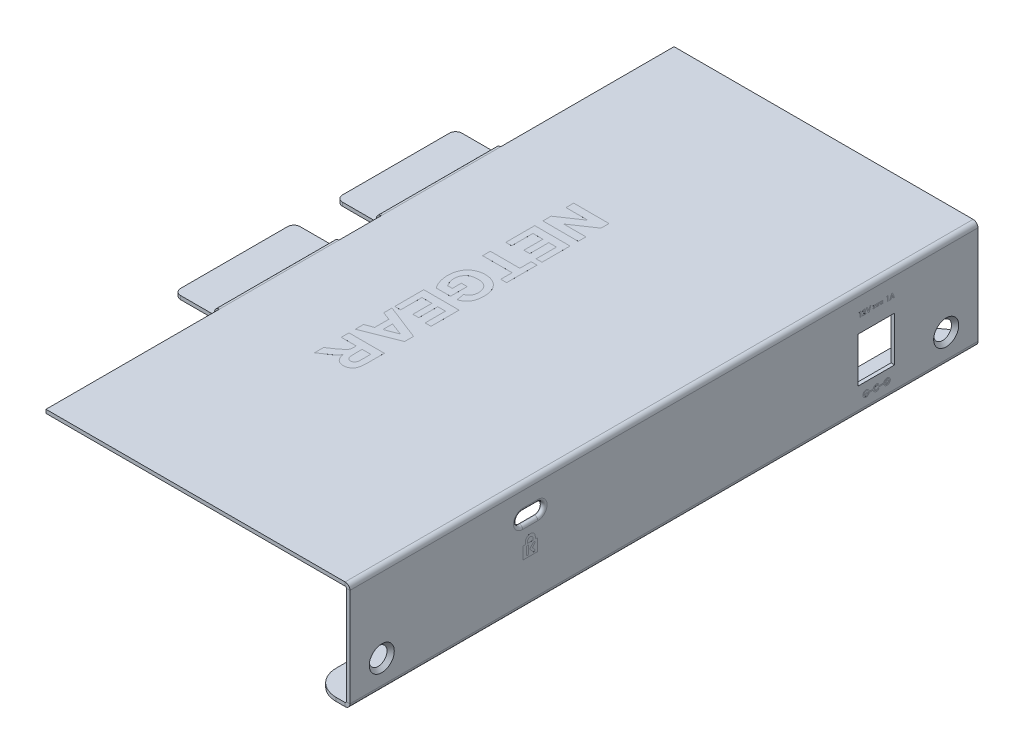
from build123d import *

# Parameters (mm, degrees)
BASE_FLANGE1_DEPTH                             = 79
FILLET1_R                                      = 6.35
SKETCH3_W                                      = 11.31316
SKETCH3_H                                      = 43.6178
SKETCH3_H_2                                    = 10.668
EXTRUDE1_DEPTH                                 = 115.263955519
FILLET2_R                                      = 1.5875
CSK_FOR_M3_FLAT_HEAD_MACHINE_SCREW1_AT_2_COUNT = 2
CSK_FOR_M3_FLAT_HEAD_MACHINE_SCREW1_AT_2_PITCH = 142
CUT_EXTRUDE1_REACH                             = 123.183
SKETCH6_W                                      = 9.1948
SKETCH6_H                                      = 11.303
EXTRUDE2_REACH                                 = 123.183
EXTRUDE3_DEPTH                                 = 0.00254
SKETCH13_R                                     = 0.568021706
SKETCH13_W                                     = 0.763751439
SKETCH13_H                                     = 0.271453824
SKETCH13_R_2                                   = 0.592897664
SKETCH13_W_2                                   = 2.509289334
SKETCH13_H_2                                   = 0.238979936
SKETCH13_W_3                                   = 0.635183515
SKETCH13_H_3                                   = 0.213824154
SKETCH13_W_4                                   = 0.678440464
SKETCH13_W_5                                   = 0.654050353
EXTRUDE8_DEPTH                                 = 0.00254
EXTRUDE9_DEPTH                                 = 0.00254
FILLET3_R                                      = 0.79375


# Sheet-metal steps are written as plain solids
with BuildPart() as part:
    # Sketch1 → Base-Flange1 (new, symmetric)
    with BuildSketch(Plane.XY):
        with BuildLine():
            Line((0, 0), (8.60044, 0))
            ThreePointArc((8.60044, 0), (9.469728793, 0.360071207), (9.8298, 1.22936))
            Line((9.8298, 1.22936), (9.8298, 25.94864))
            ThreePointArc((9.8298, 25.94864), (9.469728793, 26.817928793), (8.60044, 27.178))
            Line((8.60044, 27.178), (-66.63944, 27.178))
            ThreePointArc((-66.63944, 27.178), (-67.508728793, 26.817928793), (-67.8688, 25.94864))
            Line((-67.8688, 25.94864), (-67.8688, 25.5905))
            ThreePointArc((-67.8688, 25.5905), (-67.961793597, 25.365993597), (-68.1863, 25.273))
            Line((-68.1863, 25.273), (-77.9526, 25.273))
            Line((-77.9526, 25.273), (-77.9526, 24.36114))
            Line((-77.9526, 24.36114), (-68.1863, 24.36114))
            ThreePointArc((-68.1863, 24.36114), (-67.317011207, 24.721211207), (-66.95694, 25.5905))
            Line((-66.95694, 25.5905), (-66.95694, 25.94864))
            ThreePointArc((-66.95694, 25.94864), (-66.863946403, 26.173146403), (-66.63944, 26.26614))
            Line((-66.63944, 26.26614), (8.60044, 26.26614))
            ThreePointArc((8.60044, 26.26614), (8.824946403, 26.173146403), (8.91794, 25.94864))
            Line((8.91794, 25.94864), (8.91794, 1.22936))
            ThreePointArc((8.91794, 1.22936), (8.824946403, 1.004853597), (8.60044, 0.91186))
            Line((8.60044, 0.91186), (0, 0.91186))
            Line((0, 0.91186), (0, 0))
        make_face()
    extrude(amount=BASE_FLANGE1_DEPTH, both=True)

    # Fillet1
    fillet1_edges = [part.edges().sort_by_distance(p)[0] for p in [
        (0, 0.45593, -79),
        (0, 0.45593, 79),
    ]]
    fillet(fillet1_edges, radius=FILLET1_R)

    # Sketch3 → Extrude1 (cut, through all)
    with BuildSketch(Plane(origin=(0, 27.178, 0), x_dir=(1, 0, 0), z_dir=(0, 1, 0))):
        with Locations((-72.29602, 57.1911)):
            Rectangle(SKETCH3_W, SKETCH3_H)
        with Locations((-72.29602, 0)):
            Rectangle(SKETCH3_W, SKETCH3_H_2)
        with Locations((-72.29602, -57.1911)):
            Rectangle(SKETCH3_W, SKETCH3_H)
    extrude(amount=-EXTRUDE1_DEPTH, mode=Mode.SUBTRACT)

    # Fillet2
    fillet2_edges = [part.edges().sort_by_distance(p)[0] for p in [
        (-77.9526, 24.81707, 5.334),
        (-77.9526, 24.81707, -5.334),
        (-77.9526, 24.81707, 35.3822),
        (-77.9526, 24.81707, -35.3822),
    ]]
    fillet(fillet2_edges, radius=FILLET2_R)

    # Sketch4 → CSK for M3 Flat Head Machine Screw1 (revolve, cut)
    with BuildSketch(Plane(origin=(9.8298, 7.168042195, 71), x_dir=(0, 0, -1), z_dir=(0, 1, 0))):
        Polygon((0, 0), (0, 0.91186), (1.7, 0.91186), (1.7, 1.45), (3.15, 0), align=None)
    csk_for_m3_flat_head_machine_screw1 = revolve(axis=Axis((16.1798, 7.168042195, 71), (-1, 0, 0)), mode=Mode.SUBTRACT)

    # CSK for M3 Flat Head Machine Screw1 at 2: CSK for M3 Flat Head Machine Screw1 ×2
    with Locations(*[(0, 0, -i * CSK_FOR_M3_FLAT_HEAD_MACHINE_SCREW1_AT_2_PITCH) for i in range(1, CSK_FOR_M3_FLAT_HEAD_MACHINE_SCREW1_AT_2_COUNT)]):
        add(csk_for_m3_flat_head_machine_screw1, mode=Mode.SUBTRACT)

    # Sketch6 → Cut-Extrude1 (cut, up to next)
    with BuildSketch(Plane(origin=(9.8298, 0, 0), x_dir=(0, 0, -1), z_dir=(1, 0, 0)), mode=Mode.PRIVATE) as cut_extrude1_sk1:
        with Locations((53.4526, 12.2047)):
            Rectangle(SKETCH6_W, SKETCH6_H)
    cut_extrude1_tool1 = extrude(cut_extrude1_sk1.sketch, amount=-CUT_EXTRUDE1_REACH, mode=Mode.PRIVATE) & part.part
    add(cut_extrude1_tool1.solids().sort_by_distance((9.8298, 12.2047, -53.4526))[0], mode=Mode.SUBTRACT)

    # Sketch7 → Extrude2 (cut, up to next)
    with BuildSketch(Plane(origin=(9.8298, 0, 0), x_dir=(0, 0, -1), z_dir=(1, 0, 0)), mode=Mode.PRIVATE) as extrude2_sk1:
        with BuildLine():
            Line((-35.544, 21.348), (-31.734, 21.348))
            ThreePointArc((-31.734, 21.348), (-30.21, 19.824), (-31.734, 18.3))
            Line((-31.734, 18.3), (-35.544, 18.3))
            ThreePointArc((-35.544, 18.3), (-37.068, 19.824), (-35.544, 21.348))
        make_face()
    extrude2_tool1 = extrude(extrude2_sk1.sketch, amount=-EXTRUDE2_REACH, mode=Mode.PRIVATE) & part.part
    add(extrude2_tool1.solids().sort_by_distance((9.8298, 19.824, 33.639))[0], mode=Mode.SUBTRACT)

    # Sketch8 → Extrude3 (add)
    # profile 1 of 7: a face of its own
    with BuildSketch(Plane(origin=(0, 27.178, 0), x_dir=(1, 0, 0), z_dir=(0, 1, 0))):
        Polygon((-45.1702, 32.287834173), (-36.2802, 32.287834173), (-36.2802, 30.268351), (-41.905903125, 26.475141865), (-36.2802, 26.475141865), (-36.2802, 24.537577762), (-45.1702, 24.537577762), (-45.1702, 26.614048115), (-39.631758494, 30.35027007), (-45.1702, 30.35027007), align=None)
    # profile 2 of 7: a face of its own
    with BuildSketch(Plane(origin=(0, 27.178, 0), x_dir=(1, 0, 0), z_dir=(0, 1, 0))):
        Polygon((-45.1702, 22.486039301), (-36.2802, 22.486039301), (-36.2802, 15.419629044), (-37.761866667, 15.419629044), (-37.761866667, 20.548475198), (-39.699430769, 20.548475198), (-39.699430769, 15.761552121), (-41.181097436, 15.761552121), (-41.181097436, 20.548475198), (-43.688533333, 20.548475198), (-43.688533333, 15.191680326), (-45.1702, 15.191680326), align=None)
    # profile 3 of 7: a face of its own
    with BuildSketch(Plane(origin=(0, 27.178, 0), x_dir=(1, 0, 0), z_dir=(0, 1, 0))):
        Polygon((-45.1702, 11.316552121), (-37.761866667, 11.316552121), (-37.761866667, 14.165911096), (-36.2802, 14.165911096), (-36.2802, 6.529629044), (-37.761866667, 6.529629044), (-37.761866667, 9.378988019), (-45.1702, 9.378988019), align=None)
    # profile 4 of 7: a face of its own
    with BuildSketch(Plane(origin=(0, 27.178, 0), x_dir=(1, 0, 0), z_dir=(0, 1, 0))):
        with BuildLine():
            Line((-41.86494359, 0.716936737), (-40.383276923, 0.716936737))
            Line((-40.383276923, 0.716936737), (-40.383276923, -3.500114545))
            Line((-40.383276923, -3.500114545), (-43.955660737, -3.500114545))
            add(Edge.make_bspline(
                [(-43.955660737, -3.500114545), (-43.999634154, -3.445995515), (-44.089833092, -3.334985739), (-44.216339393, -3.154392422), (-44.337111127, -2.955737975), (-44.454642843, -2.739940934), (-44.567978704, -2.506684488), (-44.678608226, -2.256678629), (-44.785544665, -1.989595018), (-44.919935504, -1.611028337), (-45.065077999, -1.123804573), (-45.192331624, -0.529265809), (-45.269656435, 0.069624636), (-45.279336638, 0.47036367), (-45.284174359, 0.670634653)],
                knots=[0, 0, 0, 0, 0.563769275, 1.156412077, 1.781286606, 2.442915627, 3.142794723, 3.877795658, 4.653314384, 5.468651884, 7.12574302, 8.760186674, 10.380889941, 12, 12, 12, 12], degree=3))
            add(Edge.make_bspline(
                [(-45.284174359, 0.670634653), (-45.282487651, 0.795933504), (-45.279166248, 1.042667321), (-45.252180652, 1.407167835), (-45.206277762, 1.759149767), (-45.141228621, 2.098913132), (-45.062375378, 2.427193155), (-44.962579644, 2.74325418), (-44.842358832, 3.045885522), (-44.7077665, 3.336926347), (-44.554991283, 3.612632342), (-44.385360415, 3.87111646), (-44.201752666, 4.112925295), (-44.001610572, 4.336206685), (-43.785537514, 4.541800047), (-43.55338771, 4.728703067), (-43.306735244, 4.899061043), (-43.045092052, 5.049257224), (-42.773016193, 5.182694026), (-42.492910189, 5.297698545), (-42.208229826, 5.398721442), (-41.916944543, 5.478268085), (-41.620265676, 5.541146627), (-41.317492232, 5.585135672), (-41.008281033, 5.612864184), (-40.800054521, 5.61616677), (-40.694925561, 5.617834173)],
                knots=[0, 0, 0, 0, 1.184312879, 2.332104693, 3.452676445, 4.537788707, 5.600693499, 6.642414062, 7.667744385, 8.676917503, 9.671571648, 10.644283783, 11.597111852, 12.538888268, 13.475585878, 14.413274587, 15.353377862, 16.306205931, 17.26233282, 18.215821567, 19.167029038, 20.115883386, 21.067835353, 22.032012977, 23.006406887, 24, 24, 24, 24], degree=3))
            add(Edge.make_bspline(
                [(-40.694925561, 5.617834173), (-40.581489546, 5.61552875), (-40.357825173, 5.610983097), (-40.026981735, 5.58250386), (-39.706084848, 5.533278903), (-39.395512721, 5.460622533), (-39.093151923, 5.372642604), (-38.801150542, 5.26175451), (-38.518685096, 5.131086333), (-38.246203951, 4.982001086), (-37.986527363, 4.813093296), (-37.741012345, 4.625178998), (-37.511490962, 4.418266095), (-37.296374827, 4.193754812), (-37.100726486, 3.947929865), (-36.919122687, 3.685371537), (-36.749516554, 3.40604021), (-36.654316717, 3.207435312), (-36.606095433, 3.106836576)],
                knots=[0, 0, 0, 0, 1.070044041, 2.109830204, 3.129873191, 4.129610769, 5.116485034, 6.098246628, 7.072844031, 8.05020434, 9.025573574, 9.992110641, 10.963550035, 11.937873935, 12.921693347, 13.923577009, 14.948235773, 16, 16, 16, 16], degree=3))
            add(Edge.make_bspline(
                [(-36.606095433, 3.106836576), (-36.570433949, 3.02659432), (-36.498005736, 2.863622879), (-36.410737253, 2.605674611), (-36.333127595, 2.335702091), (-36.273292978, 2.049777546), (-36.225991581, 1.750166431), (-36.189402221, 1.435984819), (-36.170773382, 1.107766266), (-36.167762125, 0.884356386), (-36.166225641, 0.770362218)],
                knots=[0, 0, 0, 0, 0.879092044, 1.785429555, 2.724656739, 3.691409356, 4.70899028, 5.76218351, 6.858161382, 8, 8, 8, 8], degree=3))
            add(Edge.make_bspline(
                [(-36.166225641, 0.770362218), (-36.168225414, 0.623090773), (-36.172125129, 0.335899931), (-36.203818576, -0.082278572), (-36.258834681, -0.475429449), (-36.335234109, -0.843785553), (-36.431990631, -1.187787866), (-36.552260433, -1.506832298), (-36.691316384, -1.802271839), (-36.857374931, -2.069908635), (-37.038859229, -2.315580677), (-37.239811128, -2.536824202), (-37.455490105, -2.738029441), (-37.689891012, -2.914483228), (-37.940279624, -3.068461712), (-38.206976229, -3.198583917), (-38.490101424, -3.30680075), (-38.687364721, -3.359402247), (-38.787635897, -3.386140186)],
                knots=[0, 0, 0, 0, 1.319936612, 2.573979681, 3.756112581, 4.875815097, 5.943607219, 6.955574786, 7.928940922, 8.865214697, 9.774007493, 10.663069469, 11.540351024, 12.414026976, 13.288253621, 14.171084338, 15.070341368, 16, 16, 16, 16], degree=3))
            Line((-38.787635897, -3.386140186), (-39.129558974, -1.448576084))
            add(Edge.make_bspline(
                [(-39.129558974, -1.448576084), (-39.073365837, -1.430012778), (-38.962135123, -1.393267902), (-38.8037513, -1.320760021), (-38.653723794, -1.239567748), (-38.513492149, -1.145468143), (-38.381230171, -1.041296364), (-38.260424727, -0.921910877), (-38.145880057, -0.79457178), (-38.042451582, -0.654895633), (-37.949713072, -0.504702479), (-37.867957157, -0.345419616), (-37.799547349, -0.176093155), (-37.745784592, 0.001908811), (-37.699335616, 0.188143121), (-37.671397808, 0.383889834), (-37.649649339, 0.588230403), (-37.648487082, 0.727556801), (-37.647892308, 0.798855807)],
                knots=[0, 0, 0, 0, 0.978843869, 1.937558709, 2.87853827, 3.799609446, 4.7294949, 5.66057348, 6.60707683, 7.562109239, 8.532782522, 9.525872524, 10.522068365, 11.55073169, 12.601677106, 13.695296728, 14.820589234, 16, 16, 16, 16], degree=3))
            add(Edge.make_bspline(
                [(-37.647892308, 0.798855807), (-37.650489954, 0.906382602), (-37.655554989, 1.116044284), (-37.689073902, 1.422471783), (-37.747647948, 1.711567749), (-37.829980259, 1.983999786), (-37.934224459, 2.240363962), (-38.06616432, 2.477782563), (-38.217189951, 2.700883486), (-38.394679961, 2.904118805), (-38.5937339, 3.088174047), (-38.816646859, 3.248247957), (-39.063084749, 3.381660602), (-39.330666567, 3.493016955), (-39.622309781, 3.574882142), (-39.934525995, 3.638461137), (-40.270904808, 3.672961567), (-40.502522236, 3.677784211), (-40.621910737, 3.68027007)],
                knots=[0, 0, 0, 0, 1.095435768, 2.135941147, 3.135774115, 4.096183386, 5.031707856, 5.949232198, 6.858407501, 7.771516561, 8.691727599, 9.614795826, 10.559346608, 11.540924258, 12.561036206, 13.640327119, 14.783693395, 16, 16, 16, 16], degree=3))
            add(Edge.make_bspline(
                [(-40.621910737, 3.68027007), (-40.75022101, 3.677989692), (-40.999699088, 3.673555874), (-41.361243168, 3.63616271), (-41.697592483, 3.573783451), (-42.010324681, 3.48962552), (-42.297345284, 3.376502471), (-42.562088341, 3.242450213), (-42.798399006, 3.077811863), (-43.011555637, 2.892522423), (-43.19787633, 2.685772369), (-43.359418463, 2.462636411), (-43.497559631, 2.225783669), (-43.60786794, 1.971856505), (-43.695873322, 1.703730586), (-43.757500689, 1.419086284), (-43.795713165, 1.119264281), (-43.800213185, 0.914134283), (-43.802507692, 0.809540903)],
                knots=[0, 0, 0, 0, 1.265618701, 2.460785989, 3.580682102, 4.637735034, 5.650209671, 6.619329696, 7.558252742, 8.483784514, 9.400080475, 10.297371338, 11.197371846, 12.09940875, 13.023531345, 13.976971178, 14.968481336, 16, 16, 16, 16], degree=3))
            add(Edge.make_bspline(
                [(-43.802507692, 0.809540903), (-43.799849293, 0.703122567), (-43.794526086, 0.490029315), (-43.748414805, 0.170480021), (-43.681186537, -0.150203215), (-43.579460047, -0.465391179), (-43.463069346, -0.770554142), (-43.32743055, -1.054874341), (-43.187926149, -1.321418571), (-43.078038076, -1.483334716), (-43.024276522, -1.562550443)],
                knots=[0, 0, 0, 0, 1.00794188, 2.018313957, 3.054370546, 4.109433934, 5.153052914, 6.147084941, 7.093481301, 8, 8, 8, 8], degree=3))
            Line((-43.024276522, -1.562550443), (-41.86494359, -1.562550443))
            Line((-41.86494359, -1.562550443), (-41.86494359, 0.716936737))
        make_face()
    # profile 5 of 7: a face of its own
    with BuildSketch(Plane(origin=(0, 27.178, 0), x_dir=(1, 0, 0), z_dir=(0, 1, 0))):
        Polygon((-45.1702, -5.437678648), (-36.2802, -5.437678648), (-36.2802, -12.504088904), (-37.761866667, -12.504088904), (-37.761866667, -7.37524275), (-39.699430769, -7.37524275), (-39.699430769, -12.162165827), (-41.181097436, -12.162165827), (-41.181097436, -7.37524275), (-43.688533333, -7.37524275), (-43.688533333, -12.732037622), (-45.1702, -12.732037622), align=None)
    # profile 6 of 7: a face of its own
    with BuildSketch(Plane(origin=(0, 27.178, 0), x_dir=(1, 0, 0), z_dir=(0, 1, 0))):
        Polygon((-45.1702, -22.647806853), (-45.1702, -20.598049241), (-43.118661538, -19.816256372), (-43.118661538, -16.2670236), (-45.1702, -15.492354129), (-45.1702, -13.415883776), (-36.2802, -16.895663424), (-36.2802, -19.132410218), align=None)
        Polygon((-41.636994872, -19.249946276), (-38.445712821, -18.031845315), (-41.636994872, -16.826210299), align=None, mode=Mode.SUBTRACT)
    # profile 7 of 7: a face of its own
    with BuildSketch(Plane(origin=(0, 27.178, 0), x_dir=(1, 0, 0), z_dir=(0, 1, 0))):
        with BuildLine():
            Line((-45.1702, -24.243447879), (-36.2802, -24.243447879))
            Line((-36.2802, -24.243447879), (-36.2802, -28.330497157))
            add(Edge.make_bspline(
                [(-36.2802, -28.330497157), (-36.280905578, -28.454566595), (-36.282266377, -28.693850755), (-36.291998482, -29.039532902), (-36.312769532, -29.35885545), (-36.33580892, -29.65251956), (-36.369935628, -29.91979067), (-36.410168559, -30.160586637), (-36.457864112, -30.375353681), (-36.513388497, -30.567048772), (-36.577938534, -30.741338839), (-36.655615384, -30.902999334), (-36.744505908, -31.055940798), (-36.844603645, -31.20056311), (-36.955169045, -31.337111863), (-37.079319104, -31.463071369), (-37.212156784, -31.583526972), (-37.358530003, -31.69127956), (-37.512459193, -31.788132836), (-37.671551466, -31.875397029), (-37.837415046, -31.945461262), (-38.007920657, -32.005178495), (-38.184078864, -32.051710461), (-38.365897274, -32.08289236), (-38.552690597, -32.103446605), (-38.678948497, -32.106252599), (-38.743114663, -32.107678648)],
                knots=[0, 0, 0, 0, 1.733238924, 3.342778286, 4.829959146, 6.203159503, 7.456993021, 8.592629199, 9.61262263, 10.528460875, 11.378687967, 12.205833596, 13.030773111, 13.847376092, 14.660730453, 15.481742657, 16.315719012, 17.163232241, 18.016769036, 18.855309302, 19.694833097, 20.528809453, 21.377619937, 22.236537822, 23.103781953, 24, 24, 24, 24], degree=3))
            add(Edge.make_bspline(
                [(-38.743114663, -32.107678648), (-38.823958586, -32.106396978), (-38.982096127, -32.103889924), (-39.213720562, -32.071601441), (-39.434716648, -32.02393285), (-39.646374789, -31.959368206), (-39.844898183, -31.869730157), (-40.034735682, -31.765922422), (-40.211985377, -31.638912347), (-40.379944522, -31.495674566), (-40.532994193, -31.330604801), (-40.672919016, -31.147802564), (-40.797530148, -30.946149957), (-40.90619043, -30.725177535), (-41.000977704, -30.485967311), (-41.078294454, -30.226467027), (-41.142827362, -29.948705051), (-41.172838554, -29.756000782), (-41.188220833, -29.65722993)],
                knots=[0, 0, 0, 0, 1.011180363, 1.977954203, 2.920878389, 3.839724445, 4.741253687, 5.642629823, 6.543515848, 7.465480915, 8.401205419, 9.355275772, 10.342924245, 11.363046186, 12.433732814, 13.559612052, 14.74917563, 16, 16, 16, 16], degree=3))
            add(Edge.make_bspline(
                [(-41.188220833, -29.65722993), (-41.245616091, -29.754860384), (-41.357450456, -29.945092824), (-41.544174178, -30.209221899), (-41.737484985, -30.448988441), (-41.911552787, -30.630565043), (-42.063682252, -30.770723505), (-42.196964952, -30.882213791), (-42.351478428, -31.001068749), (-42.52316512, -31.131364845), (-42.716604693, -31.268494906), (-42.930126485, -31.413966167), (-43.1633998, -31.56897057), (-43.326294492, -31.673948795), (-43.410720833, -31.728357734)],
                knots=[0, 0, 0, 0, 1.324707174, 2.581185163, 3.78103201, 4.925725292, 5.520550109, 6.200924714, 6.958189619, 7.801461296, 8.72279761, 9.732367332, 10.824713516, 12, 12, 12, 12], degree=3))
            Line((-43.410720833, -31.728357734), (-45.1702, -32.905499161))
            Line((-45.1702, -32.905499161), (-45.1702, -30.624231132))
            Line((-45.1702, -30.624231132), (-43.186333814, -29.263662222))
            add(Edge.make_bspline(
                [(-43.186333814, -29.263662222), (-43.103660627, -29.202139819), (-42.945929057, -29.084761675), (-42.722871959, -28.913568101), (-42.524601398, -28.756523584), (-42.347253633, -28.618482223), (-42.195594923, -28.494051446), (-42.069252726, -28.383350984), (-41.965682601, -28.289217383), (-41.8594145, -28.186773754), (-41.753759028, -28.064124265), (-41.64980607, -27.914284082), (-41.56693026, -27.760269804), (-41.502728307, -27.594983684), (-41.457789786, -27.403434118), (-41.430729693, -27.172405537), (-41.410295385, -26.896086137), (-41.409483194, -26.696320462), (-41.409046154, -26.588826484)],
                knots=[0, 0, 0, 0, 1.447357252, 2.761402348, 3.948934428, 4.999732681, 5.917783254, 6.703660018, 7.358709143, 7.883429791, 8.775988904, 9.627047753, 10.440180878, 11.226720736, 12.110396497, 13.195207824, 14.490740379, 16, 16, 16, 16], degree=3))
            Line((-41.409046154, -26.588826484), (-41.409046154, -26.181011981))
            Line((-41.409046154, -26.181011981), (-45.1702, -26.181011981))
            Line((-45.1702, -26.181011981), (-45.1702, -24.243447879))
        make_face()
        with BuildLine():
            Line((-39.927379487, -26.181011981), (-39.927379487, -27.641308456))
            add(Edge.make_bspline(
                [(-39.927379487, -27.641308456), (-39.927152085, -27.75410053), (-39.926718794, -27.96901323), (-39.920439671, -28.274113044), (-39.915145368, -28.546129094), (-39.90149428, -28.784697057), (-39.888663699, -28.990293622), (-39.870929077, -29.16258149), (-39.851030768, -29.301394592), (-39.818726847, -29.44029533), (-39.764668373, -29.582472473), (-39.685091078, -29.733167412), (-39.583157093, -29.862457184), (-39.465684331, -29.975245756), (-39.327182582, -30.062281614), (-39.172554158, -30.125847028), (-39.001935977, -30.163444988), (-38.882803804, -30.167847856), (-38.821472035, -30.170114545)],
                knots=[0, 0, 0, 0, 1.726487243, 3.289628604, 4.67127743, 5.890548644, 6.947103629, 7.824141804, 8.541239058, 9.092237756, 10.003669881, 10.861576607, 11.690406528, 12.513237601, 13.342565467, 14.177845523, 15.061916244, 16, 16, 16, 16], degree=3))
            add(Edge.make_bspline(
                [(-38.821472035, -30.170114545), (-38.752870305, -30.167433344), (-38.620215452, -30.162248716), (-38.432409166, -30.111193164), (-38.26510499, -30.027759782), (-38.121219785, -29.909294144), (-37.999264514, -29.761726897), (-37.902694751, -29.585741348), (-37.831064009, -29.383453741), (-37.804319144, -29.238046097), (-37.790360256, -29.162153808)],
                knots=[0, 0, 0, 0, 1.031756031, 1.995101927, 2.907128051, 3.829100039, 4.781924549, 5.77491877, 6.838668298, 8, 8, 8, 8], degree=3))
            add(Edge.make_bspline(
                [(-37.790360256, -29.162153808), (-37.787748553, -29.137239415), (-37.781479837, -29.077438874), (-37.777682737, -28.972193696), (-37.771480886, -28.837501959), (-37.769019593, -28.672415326), (-37.764638517, -28.477733924), (-37.763834198, -28.252136884), (-37.761280343, -27.996889567), (-37.761664488, -27.816426273), (-37.761866667, -27.721446677)],
                knots=[0, 0, 0, 0, 0.417014711, 1.000935703, 1.752719665, 2.6622806, 3.749721923, 4.995169916, 6.418528545, 8, 8, 8, 8], degree=3))
            Line((-37.761866667, -27.721446677), (-37.761866667, -26.181011981))
            Line((-37.761866667, -26.181011981), (-39.927379487, -26.181011981))
        make_face(mode=Mode.SUBTRACT)
    extrude(amount=EXTRUDE3_DEPTH)

    # Sketch13 → Extrude8 (add)
    # profile 1 of 9: a face of its own
    with BuildSketch(Plane(origin=(9.8298, 0, 0), x_dir=(0, 0, -1), z_dir=(1, 0, 0))):
        with BuildLine():
            ThreePointArc((53.915801666, 3.541562743), (52.873770122, 3.848689911), (53.859626151, 4.305028299))
            Line((53.859626151, 4.305028299), (54.032678735, 4.480938893))
            ThreePointArc((54.032678735, 4.480938893), (53.196823046, 4.677897505), (52.636654442, 4.027006912))
            Line((52.636654442, 4.027006912), (51.65661797, 4.027006912))
            ThreePointArc((51.65661797, 4.027006912), (50.026385915, 3.970045919), (51.643449282, 3.755553088))
            Line((51.643449282, 3.755553088), (52.636654442, 3.755553088))
            ThreePointArc((52.636654442, 3.755553088), (53.239583119, 3.092022371), (54.092767399, 3.367472163))
            Line((54.092767399, 3.367472163), (53.915801666, 3.541562743))
        make_face()
        with Locations((50.843882736, 3.930387754)):
            Circle(SKETCH13_R, mode=Mode.SUBTRACT)
    # profile 2 of 9: a face of its own
    with BuildSketch(Plane(origin=(9.8298, 0, 0), x_dir=(0, 0, -1), z_dir=(1, 0, 0))):
        with Locations((50.857685473, 3.89128)):
            Rectangle(SKETCH13_W, SKETCH13_H)
    # profile 3 of 9: a face of its own
    with BuildSketch(Plane(origin=(9.8298, 0, 0), x_dir=(0, 0, -1), z_dir=(1, 0, 0))):
        with BuildLine():
            Line((55.298645286, 4.027006912), (53.86783074, 4.027006912))
            ThreePointArc((53.86783074, 4.027006912), (53.015749496, 3.89128), (53.86783074, 3.755553088))
            Line((53.86783074, 3.755553088), (55.298645286, 3.755553088))
            ThreePointArc((55.298645286, 3.755553088), (56.936457122, 3.89128), (55.298645286, 4.027006912))
        make_face()
        with Locations((56.111927299, 3.89128)):
            Circle(SKETCH13_R_2, mode=Mode.SUBTRACT)
    # profile 4 of 9: a face of its own
    with BuildSketch(Plane(origin=(9.8298, 0, 0), x_dir=(0, 0, -1), z_dir=(1, 0, 0))):
        Polygon((55.596625124, 3.755553088), (55.987702668, 3.755553088), (55.987702668, 3.392081017), (56.240752843, 3.392081017), (56.240752843, 3.755553088), (56.613426738, 3.755553088), (56.613426738, 3.985598702), (56.240752843, 3.985598702), (56.240752843, 4.349070772), (55.987702668, 4.349070772), (55.987702668, 3.985598702), (55.596625124, 3.985598702), align=None)
    # profile 5 of 9: a face of its own
    with BuildSketch(Plane(origin=(9.8298, 0, 0), x_dir=(0, 0, -1), z_dir=(1, 0, 0))):
        with Locations((53.814214378, 22.022205113)):
            Rectangle(SKETCH13_W_2, SKETCH13_H_2)
    # profile 6 of 9: a face of its own
    with BuildSketch(Plane(origin=(9.8298, 0, 0), x_dir=(0, 0, -1), z_dir=(1, 0, 0))):
        with Locations((52.877161469, 21.563112077)):
            Rectangle(SKETCH13_W_3, SKETCH13_H_3)
    # profile 7 of 9: a face of its own
    with BuildSketch(Plane(origin=(9.8298, 0, 0), x_dir=(0, 0, -1), z_dir=(1, 0, 0))):
        with Locations((53.791820232, 21.563112077)):
            Rectangle(SKETCH13_W_4, SKETCH13_H_3)
    # profile 8 of 9: a face of its own
    with BuildSketch(Plane(origin=(9.8298, 0, 0), x_dir=(0, 0, -1), z_dir=(1, 0, 0))):
        with Locations((54.741833869, 21.563112077)):
            Rectangle(SKETCH13_W_5, SKETCH13_H_3)
    # profile 9 of 9: a face of its own
    with BuildSketch(Plane(origin=(9.8298, 0, 0), x_dir=(0, 0, -1), z_dir=(1, 0, 0))):
        with BuildLine():
            Line((-31.845181168, 13.852984646), (-32.377140613, 13.852984646))
            Line((-32.377140613, 13.852984646), (-32.377140613, 14.384944092))
            ThreePointArc((-32.377140613, 14.384944092), (-33.637653213, 15.645456691), (-34.898165813, 14.384944092))
            Line((-34.898165813, 14.384944092), (-34.898165813, 13.852984646))
            Line((-34.898165813, 13.852984646), (-35.418560923, 13.852984646))
            Line((-35.418560923, 13.852984646), (-35.418560923, 10.8))
            Line((-35.418560923, 10.8), (-31.845181168, 10.8))
            Line((-31.845181168, 10.8), (-31.845181168, 13.852984646))
        make_face()
        with BuildLine():
            Line((-32.934922304, 13.852984646), (-34.338030305, 13.852984646))
            Line((-34.338030305, 13.852984646), (-34.338030305, 14.164621304))
            ThreePointArc((-34.338030305, 14.164621304), (-33.662564406, 14.969232032), (-32.934922304, 14.211479055))
            Line((-32.934922304, 14.211479055), (-32.934922304, 13.852984646))
        make_face(mode=Mode.SUBTRACT)
        with BuildLine():
            ThreePointArc((-34.620271559, 13.17573314), (-34.338030305, 13.457974394), (-34.05578905, 13.17573314))
            Line((-34.05578905, 13.17573314), (-34.05578905, 11.513948406))
            ThreePointArc((-34.05578905, 11.513948406), (-34.338030305, 11.231707152), (-34.620271559, 11.513948406))
            Line((-34.620271559, 11.513948406), (-34.620271559, 13.17573314))
        make_face(mode=Mode.SUBTRACT)
        with BuildLine():
            ThreePointArc((-32.891442748, 13.344355727), (-32.525319789, 13.364967262), (-32.504712323, 12.998844074))
            Line((-32.504712323, 12.998844074), (-33.096237963, 12.336765549))
            Line((-33.096237963, 12.336765549), (-32.52938879, 11.673467684))
            ThreePointArc((-32.52938879, 11.673467684), (-32.562319338, 11.309101014), (-32.926686008, 11.342031562))
            Line((-32.926686008, 11.342031562), (-33.636760131, 12.172923928))
            ThreePointArc((-33.636760131, 12.172923928), (-33.698673382, 12.343433644), (-33.633177278, 12.512599463))
            Line((-33.633177278, 12.512599463), (-32.891442748, 13.344355727))
        make_face(mode=Mode.SUBTRACT)
    extrude(amount=EXTRUDE8_DEPTH)

    # Sketch14 → Extrude9 (add)
    # profile 1 of 5: a face of its own
    with BuildSketch(Plane(origin=(9.8298, 0, 0), x_dir=(0, 0, -1), z_dir=(1, 0, 0))):
        Polygon((49.217388445, 22.5262), (49.569742211, 22.5262), (49.569742211, 21.2562), (49.341793493, 21.2562), (49.341793493, 22.314533333), (49.081280673, 22.314533333), align=None)
    # profile 2 of 5: a face of its own
    with BuildSketch(Plane(origin=(9.8298, 0, 0), x_dir=(0, 0, -1), z_dir=(1, 0, 0))):
        with BuildLine():
            Line((50.204742211, 22.102866667), (49.976793493, 22.102866667))
            add(Edge.make_bspline(
                [(49.976793493, 22.102866667), (49.977777969, 22.120109781), (49.979701575, 22.153801792), (49.987353194, 22.202740516), (49.997606101, 22.248982229), (50.011289966, 22.292365172), (50.028484638, 22.332873581), (50.048747654, 22.370645552), (50.072596687, 22.405482213), (50.099524152, 22.437215564), (50.129072894, 22.465683846), (50.160629453, 22.490925614), (50.194676529, 22.511754485), (50.230592053, 22.528894718), (50.26836991, 22.542588967), (50.308367539, 22.551744681), (50.350238617, 22.55794502), (50.37890276, 22.558487574), (50.393512243, 22.558764103)],
                knots=[0, 0, 0, 0, 1.199038563, 2.342849363, 3.436047546, 4.486744587, 5.497670872, 6.488682221, 7.459191391, 8.424610317, 9.374430501, 10.305433194, 11.225809216, 12.140057399, 13.06607119, 14.010487599, 14.985989317, 16, 16, 16, 16], degree=3))
            add(Edge.make_bspline(
                [(50.393512243, 22.558764103), (50.411445177, 22.558204548), (50.446454465, 22.557112166), (50.497325737, 22.547793784), (50.544833944, 22.532207351), (50.58894455, 22.510428993), (50.629282035, 22.482761872), (50.66583971, 22.449773358), (50.697512012, 22.410771335), (50.724499752, 22.367378614), (50.746923339, 22.321431829), (50.762636855, 22.273920949), (50.77296518, 22.226106718), (50.774066759, 22.193911035), (50.774614006, 22.177916747)],
                knots=[0, 0, 0, 0, 1.075374347, 2.099382735, 3.09057751, 4.06680945, 5.040638231, 6.016817125, 7.011024321, 8.044445721, 9.0776792, 10.070479129, 11.0414456, 12, 12, 12, 12], degree=3))
            add(Edge.make_bspline(
                [(50.774614006, 22.177916747), (50.774400937, 22.168242271), (50.773972082, 22.14876994), (50.770990194, 22.119303525), (50.766516773, 22.089288535), (50.759771945, 22.058750708), (50.751360591, 22.027681481), (50.741156403, 21.995987876), (50.728922685, 21.963849583), (50.714863592, 21.930904892), (50.698091058, 21.897046845), (50.678561775, 21.861767895), (50.655757389, 21.825099338), (50.62995335, 21.786834132), (50.601024333, 21.747032626), (50.568829117, 21.705814716), (50.533738515, 21.663035162), (50.508833727, 21.634439431), (50.496038285, 21.619747676)],
                knots=[0, 0, 0, 0, 0.728284026, 1.46585585, 2.227944881, 3.01186502, 3.81876927, 4.650621989, 5.517437689, 6.406905708, 7.346299482, 8.360816762, 9.441613733, 10.596154504, 11.834900912, 13.145207542, 14.533280747, 16, 16, 16, 16], degree=3))
            Line((50.496038285, 21.619747676), (50.363492211, 21.467866667))
            Line((50.363492211, 21.467866667), (50.790896057, 21.467866667))
            Line((50.790896057, 21.467866667), (50.790896057, 21.2562))
            Line((50.790896057, 21.2562), (49.944229391, 21.2562))
            Line((49.944229391, 21.2562), (49.944229391, 21.371700801))
            Line((49.944229391, 21.371700801), (50.320243013, 21.771883093))
            add(Edge.make_bspline(
                [(50.320243013, 21.771883093), (50.331129573, 21.783556535), (50.352213613, 21.806164529), (50.382214028, 21.839366775), (50.409361754, 21.870874913), (50.43309386, 21.901024443), (50.454655777, 21.928837436), (50.47308606, 21.95515221), (50.488553332, 21.97973087), (50.50534525, 22.009368441), (50.521292052, 22.044716519), (50.535924208, 22.085438955), (50.54484352, 22.124360224), (50.546074667, 22.14972216), (50.546665288, 22.161889103)],
                knots=[0, 0, 0, 0, 1.246127091, 2.413378631, 3.493388633, 4.492180848, 5.408488754, 6.240484944, 6.999099869, 7.674939598, 8.898438119, 10.020720584, 11.050475521, 12, 12, 12, 12], degree=3))
            add(Edge.make_bspline(
                [(50.546665288, 22.161889103), (50.546223695, 22.173659681), (50.545368037, 22.196467063), (50.535965054, 22.228910443), (50.521397626, 22.258284612), (50.500870063, 22.283711837), (50.476004755, 22.304607073), (50.447270556, 22.320148362), (50.414901734, 22.329115615), (50.392210574, 22.330237995), (50.380537484, 22.330815385)],
                knots=[0, 0, 0, 0, 1.062038974, 2.057870785, 3.028805853, 4.01125022, 4.991535629, 5.949134679, 6.94496649, 8, 8, 8, 8], degree=3))
            add(Edge.make_bspline(
                [(50.380537484, 22.330815385), (50.374507017, 22.33060209), (50.362635074, 22.330182185), (50.345184247, 22.327386993), (50.32857853, 22.322460759), (50.312633095, 22.315860299), (50.297518114, 22.307111341), (50.283271711, 22.296326857), (50.269743785, 22.283780905), (50.256996378, 22.269512714), (50.245394573, 22.253589408), (50.235089893, 22.236156415), (50.226569638, 22.217224556), (50.219068096, 22.197043759), (50.213282548, 22.175397268), (50.209069951, 22.152414633), (50.205867395, 22.128133245), (50.205124095, 22.111442074), (50.204742211, 22.102866667)],
                knots=[0, 0, 0, 0, 0.903469896, 1.778625579, 2.63899355, 3.493148037, 4.358286772, 5.247621495, 6.164656832, 7.118446693, 8.109501108, 9.111810964, 10.146451449, 11.215617525, 12.33435995, 13.498009769, 14.714554818, 16, 16, 16, 16], degree=3))
        make_face()
    # profile 3 of 5: a face of its own
    with BuildSketch(Plane(origin=(9.8298, 0, 0), x_dir=(0, 0, -1), z_dir=(1, 0, 0))):
        Polygon((50.929293493, 22.5262), (51.172761041, 22.5262), (51.499165288, 21.624072596), (51.826332756, 22.5262), (52.069037083, 22.5262), (51.60856032, 21.2562), (51.389007035, 21.2562), align=None)
    # profile 4 of 5: a face of its own
    with BuildSketch(Plane(origin=(9.8298, 0, 0), x_dir=(0, 0, -1), z_dir=(1, 0, 0))):
        Polygon((57.284997997, 22.5262), (57.496410256, 22.5262), (58.009294872, 21.2562), (57.765827324, 21.2562), (57.667117388, 21.516712821), (57.113782051, 21.516712821), (57.015072115, 21.2562), (56.771858974, 21.2562), align=None)
        Polygon((57.390576923, 22.185548958), (57.200280449, 21.744661538), (57.580873397, 21.744661538), align=None, mode=Mode.SUBTRACT)
    # profile 5 of 5: a face of its own
    with BuildSketch(Plane(origin=(9.8298, 0, 0), x_dir=(0, 0, -1), z_dir=(1, 0, 0))):
        Polygon((56.053159054, 22.5262), (56.405512821, 22.5262), (56.405512821, 21.2562), (56.177564103, 21.2562), (56.177564103, 22.314533333), (55.917051282, 22.314533333), align=None)
    extrude(amount=EXTRUDE9_DEPTH)

    # Fillet3
    fillet3_edges = [part.edges().sort_by_distance(p)[0] for p in [
        (9.8298, 19.824, 37.068),
        (9.8298, 18.3, 33.639),
        (9.8298, 19.824, 30.21),
        (9.8298, 21.348, 33.639),
    ]]
    fillet(fillet3_edges, radius=FILLET3_R)


solid = part.part
